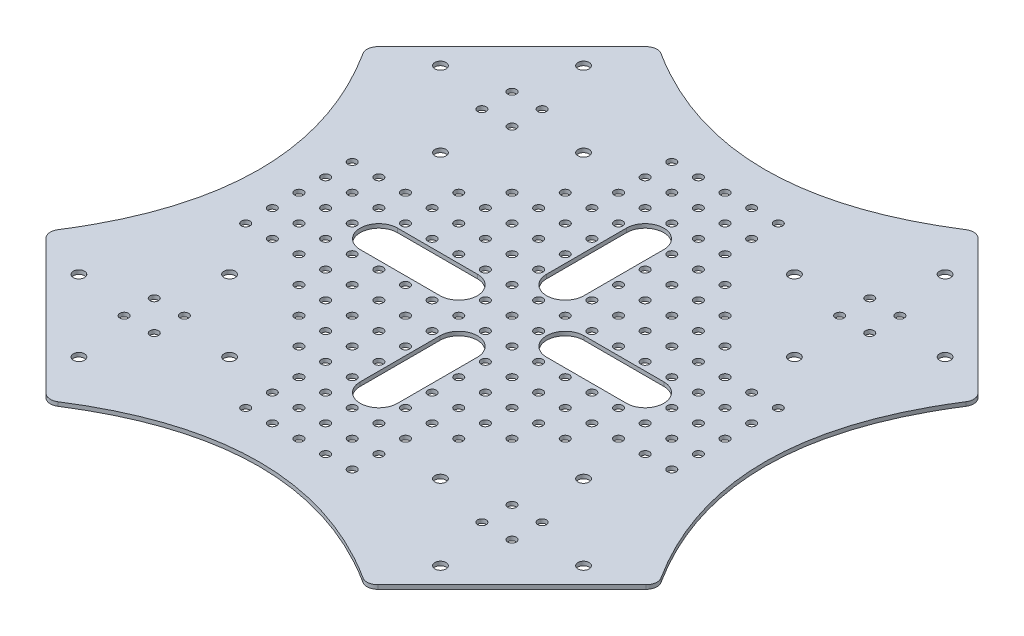
from build123d import *

# Parameters (mm, degrees)
DODANIE_WYCI_GNI_CIE1_DEPTH       = 1.5
ZAOKR_GLENIE1_R                   = 4
SZKIC2_R                          = 2.1
WYTNIJ_WYCI_GNI_CIE1_DEPTH        = 162.054010247
SZYK_KO_OWY1_COUNT                = 4
SZKIC3_R                          = 1.6
WYTNIJ_WYCI_GNI_CIE2_DEPTH        = 162.054010247
SZYK_KO_OWY2_OUTLINE_R            = 1.6
SZYK_KO_OWY2_DEPTH                = 1.5
WYTNIJ_WYCI_GNI_CIE3_REACH        = 163.054
SZKIC4_R                          = 1.6
SZYK_LINIOWY1_COUNT               = 5
SZYK_LINIOWY1_PITCH               = 10
SZYK_LINIOWY1_COUNT_DIR2          = 5
SZYK_LINIOWY1_PITCH_DIR2          = 10
SZYK_KO_OWY3_OUTLINE_R            = 1.6
SZYK_KO_OWY3_DEPTH                = 1.5
SZYK_LINIOWY2_COUNT               = 2
SZYK_LINIOWY2_PITCH               = 50
SZYK_LINIOWY3_COPY_1_REACH        = 163.054
SZYK_LINIOWY3_COPY_1_SKETCH_R     = 1.6
SZYK_LINIOWY3_COPY_2_REACH        = 163.054
SZYK_LINIOWY3_COPY_2_SKETCH_R     = 1.6
SZYK_LINIOWY3_COPY_3_REACH        = 163.054
SZYK_LINIOWY3_COPY_3_SKETCH_R     = 1.6
SZYK_LINIOWY3_COL_COPY_1_REACH    = 163.054
SZYK_LINIOWY3_COL_COPY_1_SKETCH_R = 1.6
SZYK_LINIOWY3_COL_COPY_2_REACH    = 163.054
SZYK_LINIOWY3_COL_COPY_2_SKETCH_R = 1.6
SZYK_LINIOWY3_COL_COPY_3_REACH    = 163.054
SZYK_LINIOWY3_COL_COPY_3_SKETCH_R = 1.6
SZYK_KO_OWY4_COPY_1_REACH         = 163.054
SZYK_KO_OWY4_COPY_1_SKETCH_R      = 1.6
SZYK_KO_OWY4_COPY_2_REACH         = 163.054
SZYK_KO_OWY4_COPY_2_SKETCH_R      = 1.6
SZYK_KO_OWY4_COPY_3_REACH         = 163.054
SZYK_KO_OWY4_COPY_3_SKETCH_R      = 1.6
SZYK_KO_OWY4_COPY_4_REACH         = 163.054
SZYK_KO_OWY4_COPY_4_SKETCH_R      = 1.6
SZYK_KO_OWY4_COPY_5_REACH         = 163.054
SZYK_KO_OWY4_COPY_5_SKETCH_R      = 1.6
SZYK_KO_OWY4_COPY_6_REACH         = 163.054
SZYK_KO_OWY4_COPY_6_SKETCH_R      = 1.6
SZYK_KO_OWY4_COPY_7_REACH         = 163.054
SZYK_KO_OWY4_COPY_7_SKETCH_R      = 1.6
SZYK_KO_OWY4_COPY_8_REACH         = 163.054
SZYK_KO_OWY4_COPY_8_SKETCH_R      = 1.6
SZYK_KO_OWY4_COPY_9_REACH         = 163.054
SZYK_KO_OWY4_COPY_9_SKETCH_R      = 1.6
SZYK_KO_OWY4_COPY_10_REACH        = 163.054
SZYK_KO_OWY4_COPY_10_SKETCH_R     = 1.6
SZYK_KO_OWY4_COPY_11_REACH        = 163.054
SZYK_KO_OWY4_COPY_11_SKETCH_R     = 1.6
SZYK_KO_OWY4_COPY_12_REACH        = 163.054
SZYK_KO_OWY4_COPY_12_SKETCH_R     = 1.6
SZYK_KO_OWY4_COPY_13_REACH        = 163.054
SZYK_KO_OWY4_COPY_13_SKETCH_R     = 1.6
SZYK_KO_OWY4_COPY_14_REACH        = 163.054
SZYK_KO_OWY4_COPY_14_SKETCH_R     = 1.6
SZYK_KO_OWY4_COPY_15_REACH        = 163.054
SZYK_KO_OWY4_COPY_15_SKETCH_R     = 1.6
SZYK_KO_OWY4_COPY_16_REACH        = 163.054
SZYK_KO_OWY4_COPY_16_SKETCH_R     = 1.6
SZYK_KO_OWY4_COPY_17_REACH        = 163.054
SZYK_KO_OWY4_COPY_17_SKETCH_R     = 1.6
SZYK_KO_OWY4_COPY_18_REACH        = 163.054
SZYK_KO_OWY4_COPY_18_SKETCH_R     = 1.6
SZYK_KO_OWY4_COPY_19_REACH        = 163.054
SZYK_KO_OWY4_COPY_19_SKETCH_R     = 1.6
SZYK_KO_OWY4_COPY_20_REACH        = 163.054
SZYK_KO_OWY4_COPY_20_SKETCH_R     = 1.6
SZYK_KO_OWY4_COPY_21_REACH        = 163.054
SZYK_KO_OWY4_COPY_21_SKETCH_R     = 1.6
WYTNIJ_WYCI_GNI_CIE4_DEPTH        = 162.054010247
SZYK_LINIOWY4_COUNT               = 2
SZYK_LINIOWY4_PITCH               = 60
SZYK_LINIOWY6_COPY_1_REACH        = 163.054
SZYK_LINIOWY6_COPY_1_SKETCH_R     = 1.6
SZYK_LINIOWY6_COPY_2_REACH        = 163.054
SZYK_LINIOWY6_COPY_2_SKETCH_R     = 1.6
SZYK_LINIOWY6_COL_COPY_1_REACH    = 163.054
SZYK_LINIOWY6_COL_COPY_1_SKETCH_R = 1.6
SZYK_LINIOWY6_COL_COPY_2_REACH    = 163.054
SZYK_LINIOWY6_COL_COPY_2_SKETCH_R = 1.6
SZYK_LINIOWY7_OUTLINE_R           = 1.6
SZYK_LINIOWY7_DEPTH               = 1.5
SZYK_KO_OWY5_OUTLINE_R            = 1.6
SZYK_KO_OWY5_DEPTH                = 1.5


# Read off the part's stored shape, not the designer's step: Szyk kołowy2, Szyk kołowy3, Szyk liniowy7, Szyk kołowy5
with BuildPart() as part:
    # Szkic1 → Dodanie-wyciągnięcie1 (new body)
    with BuildSketch(Plane(origin=(0, 0, 0), x_dir=(1, 0, 0), z_dir=(0, 1, 0))):
        with BuildLine():
            Line((-60, -115), (-115, -60))
            add(Edge.make_bspline(
                [(-115, 60), (-75, 0), (-115, -60)],
                knots=[0, 0, 0, 1, 1, 1], degree=2))
            Line((-115, 60), (-60, 115))
            add(Edge.make_bspline(
                [(60, 115), (0, 75), (-60, 115)],
                knots=[0, 0, 0, 1, 1, 1], degree=2))
            Line((60, 115), (115, 60))
            add(Edge.make_bspline(
                [(115, -60), (75, 0), (115, 60)],
                knots=[0, 0, 0, 1, 1, 1], degree=2))
            Line((115, -60), (60, -115))
            add(Edge.make_bspline(
                [(-60, -115), (0, -75), (60, -115)],
                knots=[0, 0, 0, 1, 1, 1], degree=2))
        make_face()
    extrude(amount=DODANIE_WYCI_GNI_CIE1_DEPTH)

    # Zaokrąglenie1
    zaokr_glenie1_edges = [part.edges().sort_by_distance(p)[0] for p in [
        (-115, 0.75, -60),
        (-60, 0.75, -115),
        (60, 0.75, -115),
        (115, 0.75, -60),
        (115, 0.75, 60),
        (60, 0.75, 115),
        (-115, 0.75, 60),
        (-60, 0.75, 115),
    ]]
    fillet(zaokr_glenie1_edges, radius=ZAOKR_GLENIE1_R)

    # Szkic2 → Wytnij-wyciągnięcie1 (cut, through all)
    with BuildSketch(Plane(origin=(0, 1.5, 0), x_dir=(1, 0, 0), z_dir=(0, 1, 0))):
        with Locations(Location((-67.882250994, -94.752308679, 0), (0, 0, 270))):
            Circle(SZKIC2_R)
        with Locations(Location((-94.752308679, -67.882250994, 0), (0, 0, 90))):
            Circle(SZKIC2_R)
        with Locations(Location((-39.597979746, -66.468037432, 0), (0, 0, 90))):
            Circle(SZKIC2_R)
        with Locations(Location((-66.468037432, -39.597979746, 0), (0, 0, 270))):
            Circle(SZKIC2_R)
    wytnij_wyci_gni_cie1 = extrude(amount=-WYTNIJ_WYCI_GNI_CIE1_DEPTH, mode=Mode.SUBTRACT)

    # Szyk kołowy1: Wytnij-wyciągnięcie1 ×4 about axis
    szyk_ko_owy1_axis = Axis((0, 0, 0), (0, 1, 0))
    for i in range(1, SZYK_KO_OWY1_COUNT):
        add(wytnij_wyci_gni_cie1.rotate(szyk_ko_owy1_axis, i * 360 / SZYK_KO_OWY1_COUNT), mode=Mode.SUBTRACT)

    # Szkic3 → Wytnij-wyciągnięcie2 (cut, through all)
    with BuildSketch(Plane(origin=(0, 1.5, 0), x_dir=(1, 0, 0), z_dir=(0, 1, 0))):
        with Locations(Location((-61.518289963, -61.518289963, 0), (0, 0, 270))):
            Circle(SZKIC3_R)
        with Locations(Location((-61.518289963, 61.518289963, 0), (0, 0, 270))):
            Circle(SZKIC3_R)
        with Locations(Location((61.518289963, 61.518289963, 0), (0, 0, 270))):
            Circle(SZKIC3_R)
        with Locations(Location((61.518289963, -61.518289963, 0), (0, 0, 270))):
            Circle(SZKIC3_R)
        with Locations(Location((-72.831998462, -72.831998462, 0), (0, 0, 270))):
            Circle(SZKIC3_R)
        with Locations(Location((-61.518289963, -72.831998462, 0), (0, 0, 270))):
            Circle(SZKIC3_R)
        with Locations(Location((-72.831998462, -61.518289963, 0), (0, 0, 270))):
            Circle(SZKIC3_R)
    wytnij_wyci_gni_cie2 = extrude(amount=-WYTNIJ_WYCI_GNI_CIE2_DEPTH, mode=Mode.SUBTRACT)

    # Lustro1: Wytnij-wyciągnięcie2 across plane
    add(wytnij_wyci_gni_cie2.mirror(Plane(origin=(0, 0, 0), x_dir=(0, 0, 1), z_dir=(1, 0, 0))), mode=Mode.SUBTRACT)

    # Szyk kołowy2 outline → Szyk kołowy2 (cut)
    with BuildSketch(Plane(origin=(0, 0, 0), x_dir=(1, 0, 0), z_dir=(0, 1, 0))):
        with Locations((-61.518289963, 72.831998462)):
            Circle(SZYK_KO_OWY2_OUTLINE_R)
        with Locations((-72.831998462, 72.831998462)):
            Circle(SZYK_KO_OWY2_OUTLINE_R)
        with Locations((-72.831998462, 61.518289963)):
            Circle(SZYK_KO_OWY2_OUTLINE_R)
        with Locations((61.518289963, 72.831998462)):
            Circle(SZYK_KO_OWY2_OUTLINE_R)
        with Locations((72.831998462, 72.831998462)):
            Circle(SZYK_KO_OWY2_OUTLINE_R)
        with Locations((72.831998462, 61.518289963)):
            Circle(SZYK_KO_OWY2_OUTLINE_R)
    extrude(amount=SZYK_KO_OWY2_DEPTH, mode=Mode.SUBTRACT)

    # Szkic4 → Wytnij-wyciągnięcie3 (cut, up to next)
    with BuildSketch(Plane(origin=(0, 1.5, 0), x_dir=(1, 0, 0), z_dir=(0, 1, 0)), mode=Mode.PRIVATE) as wytnij_wyci_gni_cie3_sk1:
        with Locations(Location((0, 0, 0), (0, 0, 270))):
            Circle(SZKIC4_R)
    wytnij_wyci_gni_cie3_tool1 = extrude(wytnij_wyci_gni_cie3_sk1.sketch, amount=-WYTNIJ_WYCI_GNI_CIE3_REACH, mode=Mode.PRIVATE) & part.part
    wytnij_wyci_gni_cie3 = wytnij_wyci_gni_cie3_tool1.solids().sort_by_distance((0, 1.5, 0))[0]
    add(wytnij_wyci_gni_cie3, mode=Mode.SUBTRACT)

    # Szyk liniowy1: Wytnij-wyci_gni_cie3 5 × 5
    with Locations(*[(j * SZYK_LINIOWY1_PITCH_DIR2, 0, i * SZYK_LINIOWY1_PITCH) for i in range(SZYK_LINIOWY1_COUNT) for j in range(SZYK_LINIOWY1_COUNT_DIR2) if (i, j) != (0, 0)]):
        add(wytnij_wyci_gni_cie3, mode=Mode.SUBTRACT)

    # Szyk kołowy3 outline → Szyk kołowy3 (cut)
    with BuildSketch(Plane(origin=(0, 0, 0), x_dir=(1, 0, 0), z_dir=(0, 1, 0))):
        with Locations((30, 40)):
            Circle(SZYK_KO_OWY3_OUTLINE_R)
        with Locations((30, 30)):
            Circle(SZYK_KO_OWY3_OUTLINE_R)
        with Locations((30, 20)):
            Circle(SZYK_KO_OWY3_OUTLINE_R)
        with Locations((40, 10)):
            Circle(SZYK_KO_OWY3_OUTLINE_R)
        with Locations((40, 20)):
            Circle(SZYK_KO_OWY3_OUTLINE_R)
        with Locations((40, 30)):
            Circle(SZYK_KO_OWY3_OUTLINE_R)
        with Locations((40, 40)):
            Circle(SZYK_KO_OWY3_OUTLINE_R)
        with Locations((0, 10)):
            Circle(SZYK_KO_OWY3_OUTLINE_R)
        with Locations((0, 20)):
            Circle(SZYK_KO_OWY3_OUTLINE_R)
        with Locations((0, 30)):
            Circle(SZYK_KO_OWY3_OUTLINE_R)
        with Locations((0, 40)):
            Circle(SZYK_KO_OWY3_OUTLINE_R)
        with Locations((10, 10)):
            Circle(SZYK_KO_OWY3_OUTLINE_R)
        with Locations((10, 20)):
            Circle(SZYK_KO_OWY3_OUTLINE_R)
        with Locations((10, 30)):
            Circle(SZYK_KO_OWY3_OUTLINE_R)
        with Locations((30, 10)):
            Circle(SZYK_KO_OWY3_OUTLINE_R)
        with Locations((20, 40)):
            Circle(SZYK_KO_OWY3_OUTLINE_R)
        with Locations((20, 30)):
            Circle(SZYK_KO_OWY3_OUTLINE_R)
        with Locations((10, 40)):
            Circle(SZYK_KO_OWY3_OUTLINE_R)
        with Locations((20, 10)):
            Circle(SZYK_KO_OWY3_OUTLINE_R)
        with Locations((20, 20)):
            Circle(SZYK_KO_OWY3_OUTLINE_R)
        with Locations((-40, 30)):
            Circle(SZYK_KO_OWY3_OUTLINE_R)
        with Locations((-30, 30)):
            Circle(SZYK_KO_OWY3_OUTLINE_R)
        with Locations((-20, 30)):
            Circle(SZYK_KO_OWY3_OUTLINE_R)
        with Locations((-10, 40)):
            Circle(SZYK_KO_OWY3_OUTLINE_R)
        with Locations((-20, 40)):
            Circle(SZYK_KO_OWY3_OUTLINE_R)
        with Locations((-30, 40)):
            Circle(SZYK_KO_OWY3_OUTLINE_R)
        with Locations((-40, 40)):
            Circle(SZYK_KO_OWY3_OUTLINE_R)
        with Locations((-10, 0)):
            Circle(SZYK_KO_OWY3_OUTLINE_R)
        with Locations((-20, 0)):
            Circle(SZYK_KO_OWY3_OUTLINE_R)
        with Locations((-30, 0)):
            Circle(SZYK_KO_OWY3_OUTLINE_R)
        with Locations((-40, 0)):
            Circle(SZYK_KO_OWY3_OUTLINE_R)
        with Locations((-10, 10)):
            Circle(SZYK_KO_OWY3_OUTLINE_R)
        with Locations((-20, 10)):
            Circle(SZYK_KO_OWY3_OUTLINE_R)
        with Locations((-30, 10)):
            Circle(SZYK_KO_OWY3_OUTLINE_R)
        with Locations((-10, 30)):
            Circle(SZYK_KO_OWY3_OUTLINE_R)
        with Locations((-40, 20)):
            Circle(SZYK_KO_OWY3_OUTLINE_R)
        with Locations((-30, 20)):
            Circle(SZYK_KO_OWY3_OUTLINE_R)
        with Locations((-40, 10)):
            Circle(SZYK_KO_OWY3_OUTLINE_R)
        with Locations((-10, 20)):
            Circle(SZYK_KO_OWY3_OUTLINE_R)
        with Locations((-20, 20)):
            Circle(SZYK_KO_OWY3_OUTLINE_R)
        with Locations((-30, -40)):
            Circle(SZYK_KO_OWY3_OUTLINE_R)
        with Locations((-30, -30)):
            Circle(SZYK_KO_OWY3_OUTLINE_R)
        with Locations((-30, -20)):
            Circle(SZYK_KO_OWY3_OUTLINE_R)
        with Locations((-40, -10)):
            Circle(SZYK_KO_OWY3_OUTLINE_R)
        with Locations((-40, -20)):
            Circle(SZYK_KO_OWY3_OUTLINE_R)
        with Locations((-40, -30)):
            Circle(SZYK_KO_OWY3_OUTLINE_R)
        with Locations((-40, -40)):
            Circle(SZYK_KO_OWY3_OUTLINE_R)
        with Locations((-10, -10)):
            Circle(SZYK_KO_OWY3_OUTLINE_R)
        with Locations((-10, -20)):
            Circle(SZYK_KO_OWY3_OUTLINE_R)
        with Locations((-10, -30)):
            Circle(SZYK_KO_OWY3_OUTLINE_R)
        with Locations((-30, -10)):
            Circle(SZYK_KO_OWY3_OUTLINE_R)
        with Locations((-20, -40)):
            Circle(SZYK_KO_OWY3_OUTLINE_R)
        with Locations((-20, -30)):
            Circle(SZYK_KO_OWY3_OUTLINE_R)
        with Locations((-10, -40)):
            Circle(SZYK_KO_OWY3_OUTLINE_R)
        with Locations((-20, -10)):
            Circle(SZYK_KO_OWY3_OUTLINE_R)
        with Locations((-20, -20)):
            Circle(SZYK_KO_OWY3_OUTLINE_R)
    extrude(amount=SZYK_KO_OWY3_DEPTH, mode=Mode.SUBTRACT)

    # Szyk liniowy2: Wytnij-wyciągnięcie3 ×2
    with Locations(*[(0, 0, i * SZYK_LINIOWY2_PITCH) for i in range(1, SZYK_LINIOWY2_COUNT)]):
        add(wytnij_wyci_gni_cie3, mode=Mode.SUBTRACT)

    # Szyk liniowy3 copy 1 sketch → Szyk liniowy3 copy 1 (cut, up to next)
    with BuildSketch(Plane(origin=(10, 1.5, 50), x_dir=(1, 0, 0), z_dir=(0, 1, 0)), mode=Mode.PRIVATE) as szyk_liniowy3_copy_1_sk1:
        with Locations(Location((0, 0, 0), (0, 0, 270))):
            Circle(SZYK_LINIOWY3_COPY_1_SKETCH_R)
    szyk_liniowy3_copy_1_tool1 = extrude(szyk_liniowy3_copy_1_sk1.sketch, amount=-SZYK_LINIOWY3_COPY_1_REACH, mode=Mode.PRIVATE) & part.part
    add(szyk_liniowy3_copy_1_tool1.solids().sort_by_distance((10, 1.5, 50))[0], mode=Mode.SUBTRACT)

    # Szyk liniowy3 copy 2 sketch → Szyk liniowy3 copy 2 (cut, up to next)
    with BuildSketch(Plane(origin=(20, 1.5, 50), x_dir=(1, 0, 0), z_dir=(0, 1, 0)), mode=Mode.PRIVATE) as szyk_liniowy3_copy_2_sk1:
        with Locations(Location((0, 0, 0), (0, 0, 270))):
            Circle(SZYK_LINIOWY3_COPY_2_SKETCH_R)
    szyk_liniowy3_copy_2_tool1 = extrude(szyk_liniowy3_copy_2_sk1.sketch, amount=-SZYK_LINIOWY3_COPY_2_REACH, mode=Mode.PRIVATE) & part.part
    add(szyk_liniowy3_copy_2_tool1.solids().sort_by_distance((20, 1.5, 50))[0], mode=Mode.SUBTRACT)

    # Szyk liniowy3 copy 3 sketch → Szyk liniowy3 copy 3 (cut, up to next)
    with BuildSketch(Plane(origin=(30, 1.5, 50), x_dir=(1, 0, 0), z_dir=(0, 1, 0)), mode=Mode.PRIVATE) as szyk_liniowy3_copy_3_sk1:
        with Locations(Location((0, 0, 0), (0, 0, 270))):
            Circle(SZYK_LINIOWY3_COPY_3_SKETCH_R)
    szyk_liniowy3_copy_3_tool1 = extrude(szyk_liniowy3_copy_3_sk1.sketch, amount=-SZYK_LINIOWY3_COPY_3_REACH, mode=Mode.PRIVATE) & part.part
    add(szyk_liniowy3_copy_3_tool1.solids().sort_by_distance((30, 1.5, 50))[0], mode=Mode.SUBTRACT)

    # Szyk liniowy3 col copy 1 sketch → Szyk liniowy3 col copy 1 (cut, up to next)
    with BuildSketch(Plane(origin=(-10, 1.5, 50), x_dir=(1, 0, 0), z_dir=(0, 1, 0)), mode=Mode.PRIVATE) as szyk_liniowy3_col_copy_1_sk1:
        with Locations(Location((0, 0, 0), (0, 0, 270))):
            Circle(SZYK_LINIOWY3_COL_COPY_1_SKETCH_R)
    szyk_liniowy3_col_copy_1_tool1 = extrude(szyk_liniowy3_col_copy_1_sk1.sketch, amount=-SZYK_LINIOWY3_COL_COPY_1_REACH, mode=Mode.PRIVATE) & part.part
    add(szyk_liniowy3_col_copy_1_tool1.solids().sort_by_distance((-10, 1.5, 50))[0], mode=Mode.SUBTRACT)

    # Szyk liniowy3 col copy 2 sketch → Szyk liniowy3 col copy 2 (cut, up to next)
    with BuildSketch(Plane(origin=(-20, 1.5, 50), x_dir=(1, 0, 0), z_dir=(0, 1, 0)), mode=Mode.PRIVATE) as szyk_liniowy3_col_copy_2_sk1:
        with Locations(Location((0, 0, 0), (0, 0, 270))):
            Circle(SZYK_LINIOWY3_COL_COPY_2_SKETCH_R)
    szyk_liniowy3_col_copy_2_tool1 = extrude(szyk_liniowy3_col_copy_2_sk1.sketch, amount=-SZYK_LINIOWY3_COL_COPY_2_REACH, mode=Mode.PRIVATE) & part.part
    add(szyk_liniowy3_col_copy_2_tool1.solids().sort_by_distance((-20, 1.5, 50))[0], mode=Mode.SUBTRACT)

    # Szyk liniowy3 col copy 3 sketch → Szyk liniowy3 col copy 3 (cut, up to next)
    with BuildSketch(Plane(origin=(-30, 1.5, 50), x_dir=(1, 0, 0), z_dir=(0, 1, 0)), mode=Mode.PRIVATE) as szyk_liniowy3_col_copy_3_sk1:
        with Locations(Location((0, 0, 0), (0, 0, 270))):
            Circle(SZYK_LINIOWY3_COL_COPY_3_SKETCH_R)
    szyk_liniowy3_col_copy_3_tool1 = extrude(szyk_liniowy3_col_copy_3_sk1.sketch, amount=-SZYK_LINIOWY3_COL_COPY_3_REACH, mode=Mode.PRIVATE) & part.part
    add(szyk_liniowy3_col_copy_3_tool1.solids().sort_by_distance((-30, 1.5, 50))[0], mode=Mode.SUBTRACT)

    # Szyk kołowy4 copy 1 sketch → Szyk kołowy4 copy 1 (cut, up to next)
    with BuildSketch(Plane(origin=(50, 1.5, 0), x_dir=(0, 0, -1), z_dir=(0, 1, 0)), mode=Mode.PRIVATE) as szyk_ko_owy4_copy_1_sk1:
        with Locations(Location((0, 0, 0), (0, 0, 270))):
            Circle(SZYK_KO_OWY4_COPY_1_SKETCH_R)
    szyk_ko_owy4_copy_1_tool1 = extrude(szyk_ko_owy4_copy_1_sk1.sketch, amount=-SZYK_KO_OWY4_COPY_1_REACH, mode=Mode.PRIVATE) & part.part
    add(szyk_ko_owy4_copy_1_tool1.solids().sort_by_distance((50, 1.5, 0))[0], mode=Mode.SUBTRACT)

    # Szyk kołowy4 copy 2 sketch → Szyk kołowy4 copy 2 (cut, up to next)
    with BuildSketch(Plane(origin=(0, 1.5, -50), x_dir=(-1, 0, 0), z_dir=(0, 1, 0)), mode=Mode.PRIVATE) as szyk_ko_owy4_copy_2_sk1:
        with Locations(Location((0, 0, 0), (0, 0, 270))):
            Circle(SZYK_KO_OWY4_COPY_2_SKETCH_R)
    szyk_ko_owy4_copy_2_tool1 = extrude(szyk_ko_owy4_copy_2_sk1.sketch, amount=-SZYK_KO_OWY4_COPY_2_REACH, mode=Mode.PRIVATE) & part.part
    add(szyk_ko_owy4_copy_2_tool1.solids().sort_by_distance((0, 1.5, -50))[0], mode=Mode.SUBTRACT)

    # Szyk kołowy4 copy 3 sketch → Szyk kołowy4 copy 3 (cut, up to next)
    with BuildSketch(Plane(origin=(-50, 1.5, 0), x_dir=(0, 0, 1), z_dir=(0, 1, 0)), mode=Mode.PRIVATE) as szyk_ko_owy4_copy_3_sk1:
        with Locations(Location((0, 0, 0), (0, 0, 270))):
            Circle(SZYK_KO_OWY4_COPY_3_SKETCH_R)
    szyk_ko_owy4_copy_3_tool1 = extrude(szyk_ko_owy4_copy_3_sk1.sketch, amount=-SZYK_KO_OWY4_COPY_3_REACH, mode=Mode.PRIVATE) & part.part
    add(szyk_ko_owy4_copy_3_tool1.solids().sort_by_distance((-50, 1.5, 0))[0], mode=Mode.SUBTRACT)

    # Szyk kołowy4 copy 4 sketch → Szyk kołowy4 copy 4 (cut, up to next)
    with BuildSketch(Plane(origin=(50, 1.5, -10), x_dir=(0, 0, -1), z_dir=(0, 1, 0)), mode=Mode.PRIVATE) as szyk_ko_owy4_copy_4_sk1:
        with Locations(Location((0, 0, 0), (0, 0, 270))):
            Circle(SZYK_KO_OWY4_COPY_4_SKETCH_R)
    szyk_ko_owy4_copy_4_tool1 = extrude(szyk_ko_owy4_copy_4_sk1.sketch, amount=-SZYK_KO_OWY4_COPY_4_REACH, mode=Mode.PRIVATE) & part.part
    add(szyk_ko_owy4_copy_4_tool1.solids().sort_by_distance((50, 1.5, -10))[0], mode=Mode.SUBTRACT)

    # Szyk kołowy4 copy 5 sketch → Szyk kołowy4 copy 5 (cut, up to next)
    with BuildSketch(Plane(origin=(-10, 1.5, -50), x_dir=(-1, 0, 0), z_dir=(0, 1, 0)), mode=Mode.PRIVATE) as szyk_ko_owy4_copy_5_sk1:
        with Locations(Location((0, 0, 0), (0, 0, 270))):
            Circle(SZYK_KO_OWY4_COPY_5_SKETCH_R)
    szyk_ko_owy4_copy_5_tool1 = extrude(szyk_ko_owy4_copy_5_sk1.sketch, amount=-SZYK_KO_OWY4_COPY_5_REACH, mode=Mode.PRIVATE) & part.part
    add(szyk_ko_owy4_copy_5_tool1.solids().sort_by_distance((-10, 1.5, -50))[0], mode=Mode.SUBTRACT)

    # Szyk kołowy4 copy 6 sketch → Szyk kołowy4 copy 6 (cut, up to next)
    with BuildSketch(Plane(origin=(-50, 1.5, 10), x_dir=(0, 0, 1), z_dir=(0, 1, 0)), mode=Mode.PRIVATE) as szyk_ko_owy4_copy_6_sk1:
        with Locations(Location((0, 0, 0), (0, 0, 270))):
            Circle(SZYK_KO_OWY4_COPY_6_SKETCH_R)
    szyk_ko_owy4_copy_6_tool1 = extrude(szyk_ko_owy4_copy_6_sk1.sketch, amount=-SZYK_KO_OWY4_COPY_6_REACH, mode=Mode.PRIVATE) & part.part
    add(szyk_ko_owy4_copy_6_tool1.solids().sort_by_distance((-50, 1.5, 10))[0], mode=Mode.SUBTRACT)

    # Szyk kołowy4 copy 7 sketch → Szyk kołowy4 copy 7 (cut, up to next)
    with BuildSketch(Plane(origin=(50, 1.5, -20), x_dir=(0, 0, -1), z_dir=(0, 1, 0)), mode=Mode.PRIVATE) as szyk_ko_owy4_copy_7_sk1:
        with Locations(Location((0, 0, 0), (0, 0, 270))):
            Circle(SZYK_KO_OWY4_COPY_7_SKETCH_R)
    szyk_ko_owy4_copy_7_tool1 = extrude(szyk_ko_owy4_copy_7_sk1.sketch, amount=-SZYK_KO_OWY4_COPY_7_REACH, mode=Mode.PRIVATE) & part.part
    add(szyk_ko_owy4_copy_7_tool1.solids().sort_by_distance((50, 1.5, -20))[0], mode=Mode.SUBTRACT)

    # Szyk kołowy4 copy 8 sketch → Szyk kołowy4 copy 8 (cut, up to next)
    with BuildSketch(Plane(origin=(-20, 1.5, -50), x_dir=(-1, 0, 0), z_dir=(0, 1, 0)), mode=Mode.PRIVATE) as szyk_ko_owy4_copy_8_sk1:
        with Locations(Location((0, 0, 0), (0, 0, 270))):
            Circle(SZYK_KO_OWY4_COPY_8_SKETCH_R)
    szyk_ko_owy4_copy_8_tool1 = extrude(szyk_ko_owy4_copy_8_sk1.sketch, amount=-SZYK_KO_OWY4_COPY_8_REACH, mode=Mode.PRIVATE) & part.part
    add(szyk_ko_owy4_copy_8_tool1.solids().sort_by_distance((-20, 1.5, -50))[0], mode=Mode.SUBTRACT)

    # Szyk kołowy4 copy 9 sketch → Szyk kołowy4 copy 9 (cut, up to next)
    with BuildSketch(Plane(origin=(-50, 1.5, 20), x_dir=(0, 0, 1), z_dir=(0, 1, 0)), mode=Mode.PRIVATE) as szyk_ko_owy4_copy_9_sk1:
        with Locations(Location((0, 0, 0), (0, 0, 270))):
            Circle(SZYK_KO_OWY4_COPY_9_SKETCH_R)
    szyk_ko_owy4_copy_9_tool1 = extrude(szyk_ko_owy4_copy_9_sk1.sketch, amount=-SZYK_KO_OWY4_COPY_9_REACH, mode=Mode.PRIVATE) & part.part
    add(szyk_ko_owy4_copy_9_tool1.solids().sort_by_distance((-50, 1.5, 20))[0], mode=Mode.SUBTRACT)

    # Szyk kołowy4 copy 10 sketch → Szyk kołowy4 copy 10 (cut, up to next)
    with BuildSketch(Plane(origin=(50, 1.5, -30), x_dir=(0, 0, -1), z_dir=(0, 1, 0)), mode=Mode.PRIVATE) as szyk_ko_owy4_copy_10_sk1:
        with Locations(Location((0, 0, 0), (0, 0, 270))):
            Circle(SZYK_KO_OWY4_COPY_10_SKETCH_R)
    szyk_ko_owy4_copy_10_tool1 = extrude(szyk_ko_owy4_copy_10_sk1.sketch, amount=-SZYK_KO_OWY4_COPY_10_REACH, mode=Mode.PRIVATE) & part.part
    add(szyk_ko_owy4_copy_10_tool1.solids().sort_by_distance((50, 1.5, -30))[0], mode=Mode.SUBTRACT)

    # Szyk kołowy4 copy 11 sketch → Szyk kołowy4 copy 11 (cut, up to next)
    with BuildSketch(Plane(origin=(-30, 1.5, -50), x_dir=(-1, 0, 0), z_dir=(0, 1, 0)), mode=Mode.PRIVATE) as szyk_ko_owy4_copy_11_sk1:
        with Locations(Location((0, 0, 0), (0, 0, 270))):
            Circle(SZYK_KO_OWY4_COPY_11_SKETCH_R)
    szyk_ko_owy4_copy_11_tool1 = extrude(szyk_ko_owy4_copy_11_sk1.sketch, amount=-SZYK_KO_OWY4_COPY_11_REACH, mode=Mode.PRIVATE) & part.part
    add(szyk_ko_owy4_copy_11_tool1.solids().sort_by_distance((-30, 1.5, -50))[0], mode=Mode.SUBTRACT)

    # Szyk kołowy4 copy 12 sketch → Szyk kołowy4 copy 12 (cut, up to next)
    with BuildSketch(Plane(origin=(-50, 1.5, 30), x_dir=(0, 0, 1), z_dir=(0, 1, 0)), mode=Mode.PRIVATE) as szyk_ko_owy4_copy_12_sk1:
        with Locations(Location((0, 0, 0), (0, 0, 270))):
            Circle(SZYK_KO_OWY4_COPY_12_SKETCH_R)
    szyk_ko_owy4_copy_12_tool1 = extrude(szyk_ko_owy4_copy_12_sk1.sketch, amount=-SZYK_KO_OWY4_COPY_12_REACH, mode=Mode.PRIVATE) & part.part
    add(szyk_ko_owy4_copy_12_tool1.solids().sort_by_distance((-50, 1.5, 30))[0], mode=Mode.SUBTRACT)

    # Szyk kołowy4 copy 13 sketch → Szyk kołowy4 copy 13 (cut, up to next)
    with BuildSketch(Plane(origin=(50, 1.5, 10), x_dir=(0, 0, -1), z_dir=(0, 1, 0)), mode=Mode.PRIVATE) as szyk_ko_owy4_copy_13_sk1:
        with Locations(Location((0, 0, 0), (0, 0, 270))):
            Circle(SZYK_KO_OWY4_COPY_13_SKETCH_R)
    szyk_ko_owy4_copy_13_tool1 = extrude(szyk_ko_owy4_copy_13_sk1.sketch, amount=-SZYK_KO_OWY4_COPY_13_REACH, mode=Mode.PRIVATE) & part.part
    add(szyk_ko_owy4_copy_13_tool1.solids().sort_by_distance((50, 1.5, 10))[0], mode=Mode.SUBTRACT)

    # Szyk kołowy4 copy 14 sketch → Szyk kołowy4 copy 14 (cut, up to next)
    with BuildSketch(Plane(origin=(10, 1.5, -50), x_dir=(-1, 0, 0), z_dir=(0, 1, 0)), mode=Mode.PRIVATE) as szyk_ko_owy4_copy_14_sk1:
        with Locations(Location((0, 0, 0), (0, 0, 270))):
            Circle(SZYK_KO_OWY4_COPY_14_SKETCH_R)
    szyk_ko_owy4_copy_14_tool1 = extrude(szyk_ko_owy4_copy_14_sk1.sketch, amount=-SZYK_KO_OWY4_COPY_14_REACH, mode=Mode.PRIVATE) & part.part
    add(szyk_ko_owy4_copy_14_tool1.solids().sort_by_distance((10, 1.5, -50))[0], mode=Mode.SUBTRACT)

    # Szyk kołowy4 copy 15 sketch → Szyk kołowy4 copy 15 (cut, up to next)
    with BuildSketch(Plane(origin=(-50, 1.5, -10), x_dir=(0, 0, 1), z_dir=(0, 1, 0)), mode=Mode.PRIVATE) as szyk_ko_owy4_copy_15_sk1:
        with Locations(Location((0, 0, 0), (0, 0, 270))):
            Circle(SZYK_KO_OWY4_COPY_15_SKETCH_R)
    szyk_ko_owy4_copy_15_tool1 = extrude(szyk_ko_owy4_copy_15_sk1.sketch, amount=-SZYK_KO_OWY4_COPY_15_REACH, mode=Mode.PRIVATE) & part.part
    add(szyk_ko_owy4_copy_15_tool1.solids().sort_by_distance((-50, 1.5, -10))[0], mode=Mode.SUBTRACT)

    # Szyk kołowy4 copy 16 sketch → Szyk kołowy4 copy 16 (cut, up to next)
    with BuildSketch(Plane(origin=(50, 1.5, 20), x_dir=(0, 0, -1), z_dir=(0, 1, 0)), mode=Mode.PRIVATE) as szyk_ko_owy4_copy_16_sk1:
        with Locations(Location((0, 0, 0), (0, 0, 270))):
            Circle(SZYK_KO_OWY4_COPY_16_SKETCH_R)
    szyk_ko_owy4_copy_16_tool1 = extrude(szyk_ko_owy4_copy_16_sk1.sketch, amount=-SZYK_KO_OWY4_COPY_16_REACH, mode=Mode.PRIVATE) & part.part
    add(szyk_ko_owy4_copy_16_tool1.solids().sort_by_distance((50, 1.5, 20))[0], mode=Mode.SUBTRACT)

    # Szyk kołowy4 copy 17 sketch → Szyk kołowy4 copy 17 (cut, up to next)
    with BuildSketch(Plane(origin=(20, 1.5, -50), x_dir=(-1, 0, 0), z_dir=(0, 1, 0)), mode=Mode.PRIVATE) as szyk_ko_owy4_copy_17_sk1:
        with Locations(Location((0, 0, 0), (0, 0, 270))):
            Circle(SZYK_KO_OWY4_COPY_17_SKETCH_R)
    szyk_ko_owy4_copy_17_tool1 = extrude(szyk_ko_owy4_copy_17_sk1.sketch, amount=-SZYK_KO_OWY4_COPY_17_REACH, mode=Mode.PRIVATE) & part.part
    add(szyk_ko_owy4_copy_17_tool1.solids().sort_by_distance((20, 1.5, -50))[0], mode=Mode.SUBTRACT)

    # Szyk kołowy4 copy 18 sketch → Szyk kołowy4 copy 18 (cut, up to next)
    with BuildSketch(Plane(origin=(-50, 1.5, -20), x_dir=(0, 0, 1), z_dir=(0, 1, 0)), mode=Mode.PRIVATE) as szyk_ko_owy4_copy_18_sk1:
        with Locations(Location((0, 0, 0), (0, 0, 270))):
            Circle(SZYK_KO_OWY4_COPY_18_SKETCH_R)
    szyk_ko_owy4_copy_18_tool1 = extrude(szyk_ko_owy4_copy_18_sk1.sketch, amount=-SZYK_KO_OWY4_COPY_18_REACH, mode=Mode.PRIVATE) & part.part
    add(szyk_ko_owy4_copy_18_tool1.solids().sort_by_distance((-50, 1.5, -20))[0], mode=Mode.SUBTRACT)

    # Szyk kołowy4 copy 19 sketch → Szyk kołowy4 copy 19 (cut, up to next)
    with BuildSketch(Plane(origin=(50, 1.5, 30), x_dir=(0, 0, -1), z_dir=(0, 1, 0)), mode=Mode.PRIVATE) as szyk_ko_owy4_copy_19_sk1:
        with Locations(Location((0, 0, 0), (0, 0, 270))):
            Circle(SZYK_KO_OWY4_COPY_19_SKETCH_R)
    szyk_ko_owy4_copy_19_tool1 = extrude(szyk_ko_owy4_copy_19_sk1.sketch, amount=-SZYK_KO_OWY4_COPY_19_REACH, mode=Mode.PRIVATE) & part.part
    add(szyk_ko_owy4_copy_19_tool1.solids().sort_by_distance((50, 1.5, 30))[0], mode=Mode.SUBTRACT)

    # Szyk kołowy4 copy 20 sketch → Szyk kołowy4 copy 20 (cut, up to next)
    with BuildSketch(Plane(origin=(30, 1.5, -50), x_dir=(-1, 0, 0), z_dir=(0, 1, 0)), mode=Mode.PRIVATE) as szyk_ko_owy4_copy_20_sk1:
        with Locations(Location((0, 0, 0), (0, 0, 270))):
            Circle(SZYK_KO_OWY4_COPY_20_SKETCH_R)
    szyk_ko_owy4_copy_20_tool1 = extrude(szyk_ko_owy4_copy_20_sk1.sketch, amount=-SZYK_KO_OWY4_COPY_20_REACH, mode=Mode.PRIVATE) & part.part
    add(szyk_ko_owy4_copy_20_tool1.solids().sort_by_distance((30, 1.5, -50))[0], mode=Mode.SUBTRACT)

    # Szyk kołowy4 copy 21 sketch → Szyk kołowy4 copy 21 (cut, up to next)
    with BuildSketch(Plane(origin=(-50, 1.5, -30), x_dir=(0, 0, 1), z_dir=(0, 1, 0)), mode=Mode.PRIVATE) as szyk_ko_owy4_copy_21_sk1:
        with Locations(Location((0, 0, 0), (0, 0, 270))):
            Circle(SZYK_KO_OWY4_COPY_21_SKETCH_R)
    szyk_ko_owy4_copy_21_tool1 = extrude(szyk_ko_owy4_copy_21_sk1.sketch, amount=-SZYK_KO_OWY4_COPY_21_REACH, mode=Mode.PRIVATE) & part.part
    add(szyk_ko_owy4_copy_21_tool1.solids().sort_by_distance((-50, 1.5, -30))[0], mode=Mode.SUBTRACT)

    # Szkic5 → Wytnij-wyciągnięcie4 (cut, through all)
    with BuildSketch(Plane(origin=(0, 1.5, 0), x_dir=(1, 0, 0), z_dir=(0, 1, 0))):
        with BuildLine():
            Line((-20, -7), (-50, -7))
            ThreePointArc((-50, -7), (-57, 0), (-50, 7))
            Line((-50, 7), (-20, 7))
            ThreePointArc((-20, 7), (-13, 0), (-20, -7))
        make_face()
        with BuildLine():
            Line((7, 20), (7, 50))
            ThreePointArc((7, 50), (0, 57), (-7, 50))
            Line((-7, 50), (-7, 20))
            ThreePointArc((-7, 20), (0, 13), (7, 20))
        make_face()
        with BuildLine():
            Line((20, -7), (50, -7))
            ThreePointArc((50, -7), (57, 0), (50, 7))
            Line((50, 7), (20, 7))
            ThreePointArc((20, 7), (13, 0), (20, -7))
        make_face()
        with BuildLine():
            Line((-7, -20), (-7, -50))
            ThreePointArc((-7, -50), (0, -57), (7, -50))
            Line((7, -50), (7, -20))
            ThreePointArc((7, -20), (0, -13), (-7, -20))
        make_face()
    extrude(amount=-WYTNIJ_WYCI_GNI_CIE4_DEPTH, mode=Mode.SUBTRACT)

    # Szyk liniowy4: Wytnij-wyciągnięcie3 ×2
    with Locations(*[(0, 0, i * SZYK_LINIOWY4_PITCH) for i in range(1, SZYK_LINIOWY4_COUNT)]):
        add(wytnij_wyci_gni_cie3, mode=Mode.SUBTRACT)

    # Szyk liniowy6 copy 1 sketch → Szyk liniowy6 copy 1 (cut, up to next)
    with BuildSketch(Plane(origin=(10, 1.5, 60), x_dir=(1, 0, 0), z_dir=(0, 1, 0)), mode=Mode.PRIVATE) as szyk_liniowy6_copy_1_sk1:
        with Locations(Location((0, 0, 0), (0, 0, 270))):
            Circle(SZYK_LINIOWY6_COPY_1_SKETCH_R)
    szyk_liniowy6_copy_1_tool1 = extrude(szyk_liniowy6_copy_1_sk1.sketch, amount=-SZYK_LINIOWY6_COPY_1_REACH, mode=Mode.PRIVATE) & part.part
    add(szyk_liniowy6_copy_1_tool1.solids().sort_by_distance((10, 1.5, 60))[0], mode=Mode.SUBTRACT)

    # Szyk liniowy6 copy 2 sketch → Szyk liniowy6 copy 2 (cut, up to next)
    with BuildSketch(Plane(origin=(20, 1.5, 60), x_dir=(1, 0, 0), z_dir=(0, 1, 0)), mode=Mode.PRIVATE) as szyk_liniowy6_copy_2_sk1:
        with Locations(Location((0, 0, 0), (0, 0, 270))):
            Circle(SZYK_LINIOWY6_COPY_2_SKETCH_R)
    szyk_liniowy6_copy_2_tool1 = extrude(szyk_liniowy6_copy_2_sk1.sketch, amount=-SZYK_LINIOWY6_COPY_2_REACH, mode=Mode.PRIVATE) & part.part
    add(szyk_liniowy6_copy_2_tool1.solids().sort_by_distance((20, 1.5, 60))[0], mode=Mode.SUBTRACT)

    # Szyk liniowy6 col copy 1 sketch → Szyk liniowy6 col copy 1 (cut, up to next)
    with BuildSketch(Plane(origin=(-10, 1.5, 60), x_dir=(1, 0, 0), z_dir=(0, 1, 0)), mode=Mode.PRIVATE) as szyk_liniowy6_col_copy_1_sk1:
        with Locations(Location((0, 0, 0), (0, 0, 270))):
            Circle(SZYK_LINIOWY6_COL_COPY_1_SKETCH_R)
    szyk_liniowy6_col_copy_1_tool1 = extrude(szyk_liniowy6_col_copy_1_sk1.sketch, amount=-SZYK_LINIOWY6_COL_COPY_1_REACH, mode=Mode.PRIVATE) & part.part
    add(szyk_liniowy6_col_copy_1_tool1.solids().sort_by_distance((-10, 1.5, 60))[0], mode=Mode.SUBTRACT)

    # Szyk liniowy6 col copy 2 sketch → Szyk liniowy6 col copy 2 (cut, up to next)
    with BuildSketch(Plane(origin=(-20, 1.5, 60), x_dir=(1, 0, 0), z_dir=(0, 1, 0)), mode=Mode.PRIVATE) as szyk_liniowy6_col_copy_2_sk1:
        with Locations(Location((0, 0, 0), (0, 0, 270))):
            Circle(SZYK_LINIOWY6_COL_COPY_2_SKETCH_R)
    szyk_liniowy6_col_copy_2_tool1 = extrude(szyk_liniowy6_col_copy_2_sk1.sketch, amount=-SZYK_LINIOWY6_COL_COPY_2_REACH, mode=Mode.PRIVATE) & part.part
    add(szyk_liniowy6_col_copy_2_tool1.solids().sort_by_distance((-20, 1.5, 60))[0], mode=Mode.SUBTRACT)

    # Szyk liniowy7 outline → Szyk liniowy7 (cut)
    with BuildSketch(Plane(origin=(0, 0, 0), x_dir=(1, 0, 0), z_dir=(0, 1, 0))):
        with Locations((-20, -80)):
            Circle(SZYK_LINIOWY7_OUTLINE_R)
        with Locations((-20, -70)):
            Circle(SZYK_LINIOWY7_OUTLINE_R)
        with Locations((0, -80)):
            Circle(SZYK_LINIOWY7_OUTLINE_R)
        with Locations((0, -70)):
            Circle(SZYK_LINIOWY7_OUTLINE_R)
        with Locations((10, -80)):
            Circle(SZYK_LINIOWY7_OUTLINE_R)
        with Locations((10, -70)):
            Circle(SZYK_LINIOWY7_OUTLINE_R)
        with Locations((20, -80)):
            Circle(SZYK_LINIOWY7_OUTLINE_R)
        with Locations((20, -70)):
            Circle(SZYK_LINIOWY7_OUTLINE_R)
        with Locations((-10, -80)):
            Circle(SZYK_LINIOWY7_OUTLINE_R)
        with Locations((-10, -70)):
            Circle(SZYK_LINIOWY7_OUTLINE_R)
    extrude(amount=SZYK_LINIOWY7_DEPTH, mode=Mode.SUBTRACT)

    # Szyk kołowy5 outline → Szyk kołowy5 (cut)
    with BuildSketch(Plane(origin=(0, 0, 0), x_dir=(1, 0, 0), z_dir=(0, 1, 0))):
        with Locations((80, -20)):
            Circle(SZYK_KO_OWY5_OUTLINE_R)
        with Locations((70, -20)):
            Circle(SZYK_KO_OWY5_OUTLINE_R)
        with Locations((60, -20)):
            Circle(SZYK_KO_OWY5_OUTLINE_R)
        with Locations((80, 0)):
            Circle(SZYK_KO_OWY5_OUTLINE_R)
        with Locations((70, 0)):
            Circle(SZYK_KO_OWY5_OUTLINE_R)
        with Locations((60, 0)):
            Circle(SZYK_KO_OWY5_OUTLINE_R)
        with Locations((80, 10)):
            Circle(SZYK_KO_OWY5_OUTLINE_R)
        with Locations((70, 10)):
            Circle(SZYK_KO_OWY5_OUTLINE_R)
        with Locations((60, 10)):
            Circle(SZYK_KO_OWY5_OUTLINE_R)
        with Locations((80, 20)):
            Circle(SZYK_KO_OWY5_OUTLINE_R)
        with Locations((70, 20)):
            Circle(SZYK_KO_OWY5_OUTLINE_R)
        with Locations((60, 20)):
            Circle(SZYK_KO_OWY5_OUTLINE_R)
        with Locations((80, -10)):
            Circle(SZYK_KO_OWY5_OUTLINE_R)
        with Locations((70, -10)):
            Circle(SZYK_KO_OWY5_OUTLINE_R)
        with Locations((60, -10)):
            Circle(SZYK_KO_OWY5_OUTLINE_R)
        with Locations((20, 80)):
            Circle(SZYK_KO_OWY5_OUTLINE_R)
        with Locations((20, 70)):
            Circle(SZYK_KO_OWY5_OUTLINE_R)
        with Locations((20, 60)):
            Circle(SZYK_KO_OWY5_OUTLINE_R)
        with Locations((0, 80)):
            Circle(SZYK_KO_OWY5_OUTLINE_R)
        with Locations((0, 70)):
            Circle(SZYK_KO_OWY5_OUTLINE_R)
        with Locations((0, 60)):
            Circle(SZYK_KO_OWY5_OUTLINE_R)
        with Locations((-10, 80)):
            Circle(SZYK_KO_OWY5_OUTLINE_R)
        with Locations((-10, 70)):
            Circle(SZYK_KO_OWY5_OUTLINE_R)
        with Locations((-10, 60)):
            Circle(SZYK_KO_OWY5_OUTLINE_R)
        with Locations((-20, 80)):
            Circle(SZYK_KO_OWY5_OUTLINE_R)
        with Locations((-20, 70)):
            Circle(SZYK_KO_OWY5_OUTLINE_R)
        with Locations((-20, 60)):
            Circle(SZYK_KO_OWY5_OUTLINE_R)
        with Locations((10, 80)):
            Circle(SZYK_KO_OWY5_OUTLINE_R)
        with Locations((10, 70)):
            Circle(SZYK_KO_OWY5_OUTLINE_R)
        with Locations((10, 60)):
            Circle(SZYK_KO_OWY5_OUTLINE_R)
        with Locations((-80, 20)):
            Circle(SZYK_KO_OWY5_OUTLINE_R)
        with Locations((-70, 20)):
            Circle(SZYK_KO_OWY5_OUTLINE_R)
        with Locations((-60, 20)):
            Circle(SZYK_KO_OWY5_OUTLINE_R)
        with Locations((-80, 0)):
            Circle(SZYK_KO_OWY5_OUTLINE_R)
        with Locations((-70, 0)):
            Circle(SZYK_KO_OWY5_OUTLINE_R)
        with Locations((-60, 0)):
            Circle(SZYK_KO_OWY5_OUTLINE_R)
        with Locations((-80, -10)):
            Circle(SZYK_KO_OWY5_OUTLINE_R)
        with Locations((-70, -10)):
            Circle(SZYK_KO_OWY5_OUTLINE_R)
        with Locations((-60, -10)):
            Circle(SZYK_KO_OWY5_OUTLINE_R)
        with Locations((-80, -20)):
            Circle(SZYK_KO_OWY5_OUTLINE_R)
        with Locations((-70, -20)):
            Circle(SZYK_KO_OWY5_OUTLINE_R)
        with Locations((-60, -20)):
            Circle(SZYK_KO_OWY5_OUTLINE_R)
        with Locations((-80, 10)):
            Circle(SZYK_KO_OWY5_OUTLINE_R)
        with Locations((-70, 10)):
            Circle(SZYK_KO_OWY5_OUTLINE_R)
        with Locations((-60, 10)):
            Circle(SZYK_KO_OWY5_OUTLINE_R)
    extrude(amount=SZYK_KO_OWY5_DEPTH, mode=Mode.SUBTRACT)


solid = part.part
